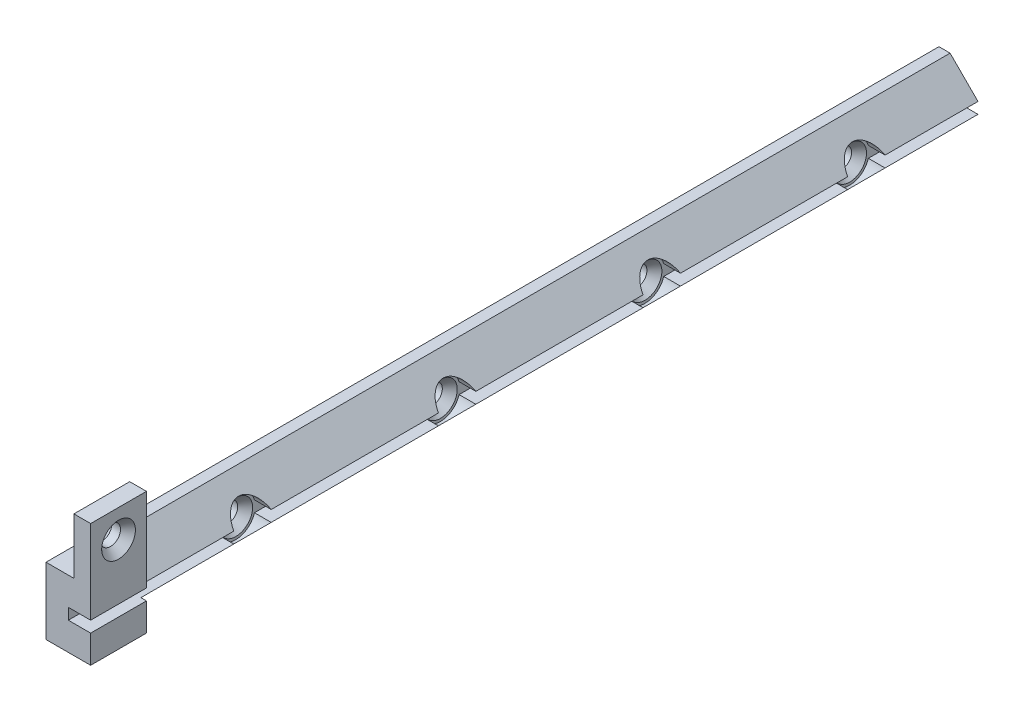
from build123d import *

# Parameters (mm, degrees)
BOSS_EXTRUDE1_DEPTH                            = 75
SKETCH5_R                                      = 1.75
CUT_EXTRUDE1_DEPTH                             = 2
CSK_FOR_0_FLAT_HEAD_MACHINE_SCREW2_D           = 1.778
CSK_FOR_0_FLAT_HEAD_MACHINE_SCREW2_DEPTH       = 3.302
CSK_FOR_0_FLAT_HEAD_MACHINE_SCREW2_CSINK_D     = 3.0226
CSK_FOR_0_FLAT_HEAD_MACHINE_SCREW2_CSINK_ANGLE = 82
CSK_FOR_0_FLAT_HEAD_MACHINE_SCREW2_TIP         = 0.53416509
CHAMFER1_SIZE                                  = 3
SKETCH6_W                                      = 1.5
SKETCH6_H                                      = 5
BOSS_EXTRUDE2_DEPTH                            = 5
CSK_FOR_0_FLAT_HEAD_MACHINE_SCREW1_D           = 1.778
CSK_FOR_0_FLAT_HEAD_MACHINE_SCREW1_DEPTH       = 3.302
CSK_FOR_0_FLAT_HEAD_MACHINE_SCREW1_CSINK_D     = 3.0226
CSK_FOR_0_FLAT_HEAD_MACHINE_SCREW1_CSINK_ANGLE = 82
CSK_FOR_0_FLAT_HEAD_MACHINE_SCREW1_TIP         = 0.53416509


with BuildPart() as part:
    # Sketch1 → Boss-Extrude1 (new body)
    with BuildSketch(Plane.XY):
        Polygon((-2, -3), (2, -3), (2, -0.5), (0, -0.5), (0, 0.5), (2, 0.5), (2, 3), (-2, 3), align=None)
    extrude(amount=BOSS_EXTRUDE1_DEPTH)

    # Sketch5 → Cut-Extrude1 (cut)
    with BuildSketch(Plane(origin=(2, 0, 0), x_dir=(0, 0, -1), z_dir=(1, 0, 0))):
        with Locations((-65, 0)):
            Circle(SKETCH5_R)
        with Locations((-46.66667, 0)):
            Circle(SKETCH5_R)
        with Locations((-28.33334, 0)):
            Circle(SKETCH5_R)
        with Locations((-10.00001, 0)):
            Circle(SKETCH5_R)
    extrude(amount=-CUT_EXTRUDE1_DEPTH, mode=Mode.SUBTRACT)

    # CSK for #0 Flat Head Machine Screw2
    with Locations(Plane(origin=(0, 0, 0), x_dir=(0, 0, -1), z_dir=(1, 0, 0))):
        with Locations((-65, 0), (-10.00001, 0), (-46.66667, 0), (-28.33334, 0)):
            CounterSinkHole(CSK_FOR_0_FLAT_HEAD_MACHINE_SCREW2_D / 2, CSK_FOR_0_FLAT_HEAD_MACHINE_SCREW2_CSINK_D / 2, depth=CSK_FOR_0_FLAT_HEAD_MACHINE_SCREW2_DEPTH, counter_sink_angle=CSK_FOR_0_FLAT_HEAD_MACHINE_SCREW2_CSINK_ANGLE)
            with Locations((0, 0, -(CSK_FOR_0_FLAT_HEAD_MACHINE_SCREW2_DEPTH + CSK_FOR_0_FLAT_HEAD_MACHINE_SCREW2_TIP / 2))):  # 118° drill point
                Cone(0, CSK_FOR_0_FLAT_HEAD_MACHINE_SCREW2_D / 2, CSK_FOR_0_FLAT_HEAD_MACHINE_SCREW2_TIP, mode=Mode.SUBTRACT)

    # Chamfer1
    # the kernel refuses this chamfer: 3 mm, written as the material it takes off along each edge
    with BuildSketch(Plane(origin=(2, -3, -7.715048964), x_dir=(-0.9996219169112968, -0.027495876610586348, 0), z_dir=(0, 0, 1))) as chamfer1_piece_1:
        Polygon((CHAMFER1_SIZE * 0.999621916911, -CHAMFER1_SIZE * 0.0274958766106), (-CHAMFER1_SIZE * 0.0274958766106, -CHAMFER1_SIZE * 0.999621916911), (0, 0), align=None)
    extrude(amount=90.430097928, mode=Mode.SUBTRACT)
    with BuildSketch(Plane(origin=(2, 3, -7.715048964), x_dir=(-0.9996219169112968, 0.027495876610586348, 0), z_dir=(0, 0, 1))) as chamfer1_piece_2:
        Polygon((CHAMFER1_SIZE * 0.999621916911, CHAMFER1_SIZE * 0.0274958766106), (-CHAMFER1_SIZE * 0.0274958766106, CHAMFER1_SIZE * 0.999621916911), (0, 0), align=None)
    extrude(amount=90.430097928, mode=Mode.SUBTRACT)

    # Sketch6 → Boss-Extrude2 (add)
    with BuildSketch(Plane.XY.offset(75)):
        Polygon((2, 0.5), (2, 3), (0.5, 3), (-2, 3), (-2, -3), (2, -3), (2, -0.5), (0, -0.5), (0, 0.5), align=None)
        with Locations((1.25, 5.5)):
            Rectangle(SKETCH6_W, SKETCH6_H)
    extrude(amount=BOSS_EXTRUDE2_DEPTH)

    # CSK for #0 Flat Head Machine Screw1
    with Locations(Plane(origin=(2, 0, 0), x_dir=(0, 0, -1), z_dir=(1, 0, 0))):
        with Locations((-77.5, 5.5)):
            CounterSinkHole(CSK_FOR_0_FLAT_HEAD_MACHINE_SCREW1_D / 2, CSK_FOR_0_FLAT_HEAD_MACHINE_SCREW1_CSINK_D / 2, depth=CSK_FOR_0_FLAT_HEAD_MACHINE_SCREW1_DEPTH, counter_sink_angle=CSK_FOR_0_FLAT_HEAD_MACHINE_SCREW1_CSINK_ANGLE)
            with Locations((0, 0, -(CSK_FOR_0_FLAT_HEAD_MACHINE_SCREW1_DEPTH + CSK_FOR_0_FLAT_HEAD_MACHINE_SCREW1_TIP / 2))):  # 118° drill point
                Cone(0, CSK_FOR_0_FLAT_HEAD_MACHINE_SCREW1_D / 2, CSK_FOR_0_FLAT_HEAD_MACHINE_SCREW1_TIP, mode=Mode.SUBTRACT)


solid = part.part
